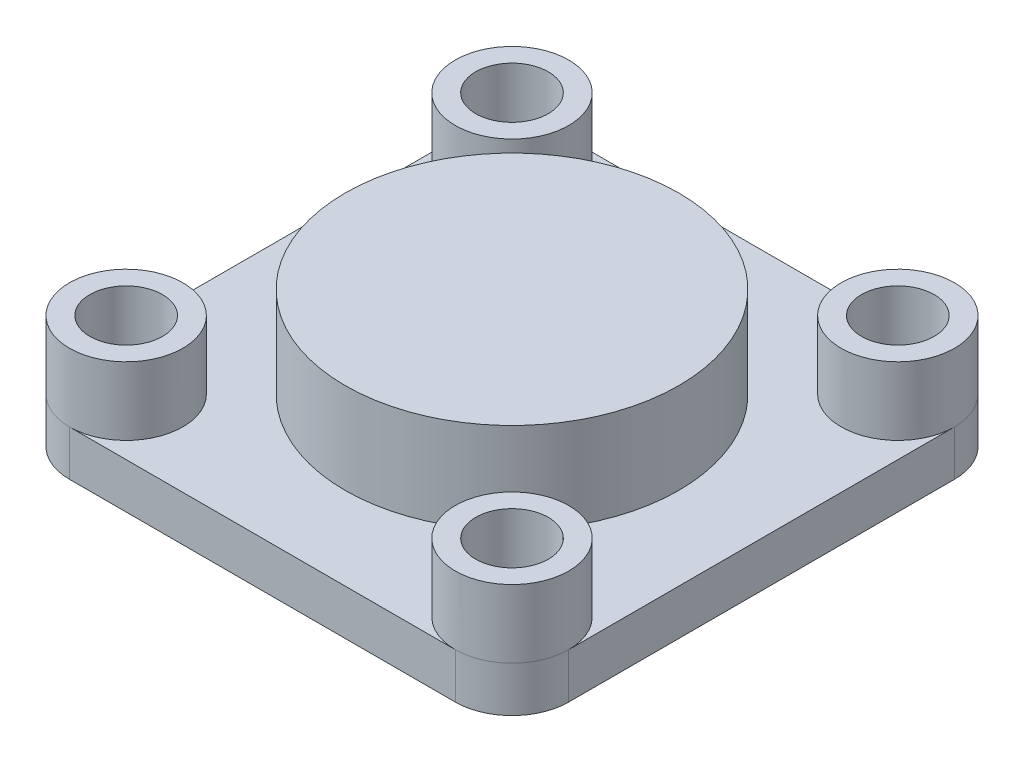
from build123d import *

# Parameters (mm, degrees)
SKETCH1_W           = 22
SKETCH1_H           = 22
BOSS_EXTRUDE1_DEPTH = 2
SKETCH2_R           = 7.35
BOSS_EXTRUDE2_DEPTH = 4
SKETCH3_R           = 2.5
BOSS_EXTRUDE3_DEPTH = 3
SKETCH4_R           = 1.6
CUT_EXTRUDE1_DEPTH  = 17.340134638
CIRPATTERN1_COUNT   = 4
FILLET1_R           = 2.5


with BuildPart() as part:
    # Sketch1 → Boss-Extrude1 (new body)
    with BuildSketch(Plane(origin=(0, 0, 0), x_dir=(1, 0, 0), z_dir=(0, 1, 0))):
        Rectangle(SKETCH1_W, SKETCH1_H)
    extrude(amount=BOSS_EXTRUDE1_DEPTH)

    # Sketch2 → Boss-Extrude2 (add)
    with BuildSketch(Plane(origin=(0, 2, 0), x_dir=(1, 0, 0), z_dir=(0, 1, 0))):
        Circle(SKETCH2_R)
    extrude(amount=BOSS_EXTRUDE2_DEPTH)

    # Sketch3 → Boss-Extrude3 (add)
    with BuildSketch(Plane(origin=(0, 2, 0), x_dir=(1, 0, 0), z_dir=(0, 1, 0))):
        with Locations((-8.5, -8.5)):
            Circle(SKETCH3_R)
    boss_extrude3 = extrude(amount=BOSS_EXTRUDE3_DEPTH)

    # Sketch4 → Cut-Extrude1 (cut, through all)
    with BuildSketch(Plane(origin=(0, 5, 0), x_dir=(1, 0, 0), z_dir=(0, 1, 0))):
        with Locations((-8.5, -8.5)):
            Circle(SKETCH4_R)
    cut_extrude1 = extrude(amount=-CUT_EXTRUDE1_DEPTH, mode=Mode.SUBTRACT)

    # CirPattern1: Boss-Extrude3, Cut-Extrude1 ×4 about axis
    cirpattern1_axis = Axis((0, 6, 0), (0, -1, 0))
    add([boss_extrude3.rotate(cirpattern1_axis, i * 360 / CIRPATTERN1_COUNT) for i in range(1, CIRPATTERN1_COUNT)])
    add([cut_extrude1.rotate(cirpattern1_axis, i * 360 / CIRPATTERN1_COUNT) for i in range(1, CIRPATTERN1_COUNT)], mode=Mode.SUBTRACT)

    # Fillet1
    fillet1_edges = [part.edges().sort_by_distance(p)[0] for p in [
        (11, 1, -11),
        (-11, 1, -11),
        (11, 1, 11),
        (-11, 1, 11),
    ]]
    fillet(fillet1_edges, radius=FILLET1_R)


solid = part.part
